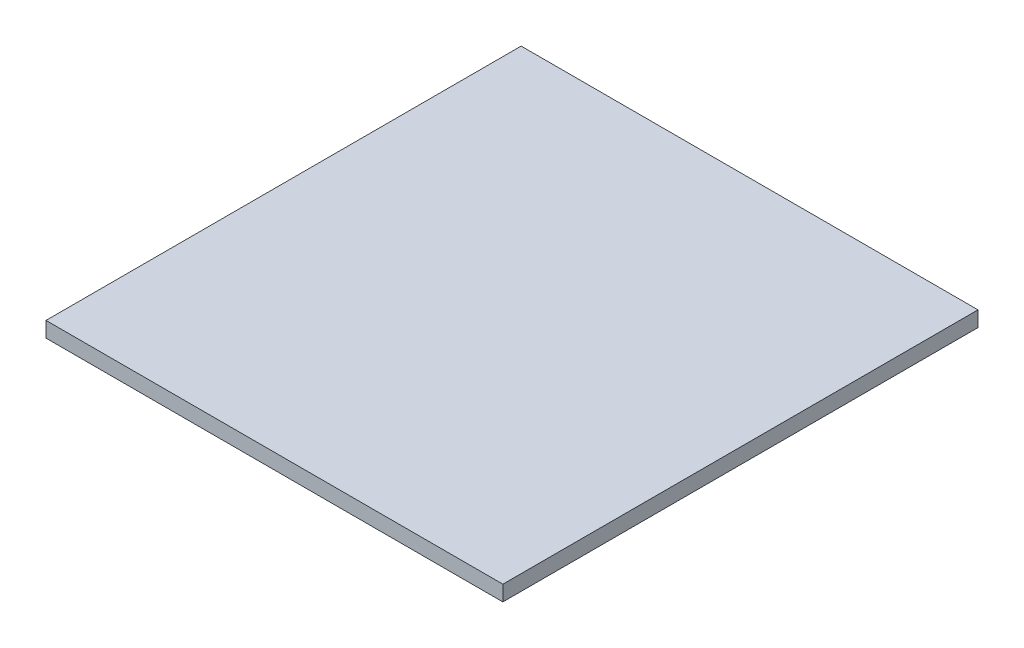
from build123d import *

# Parameters (mm, degrees)
SKETCH1_W           = 95
SKETCH1_H           = 98.8
BOSS_EXTRUDE1_DEPTH = 3.2


with BuildPart() as part:
    # Sketch1 → Boss-Extrude1 (new body)
    with BuildSketch(Plane(origin=(0, 0, 0), x_dir=(1, 0, 0), z_dir=(0, 1, 0))):
        with Locations((3.218457944, -28.701985981)):
            Rectangle(SKETCH1_W, SKETCH1_H)
    extrude(amount=BOSS_EXTRUDE1_DEPTH)


solid = part.part
